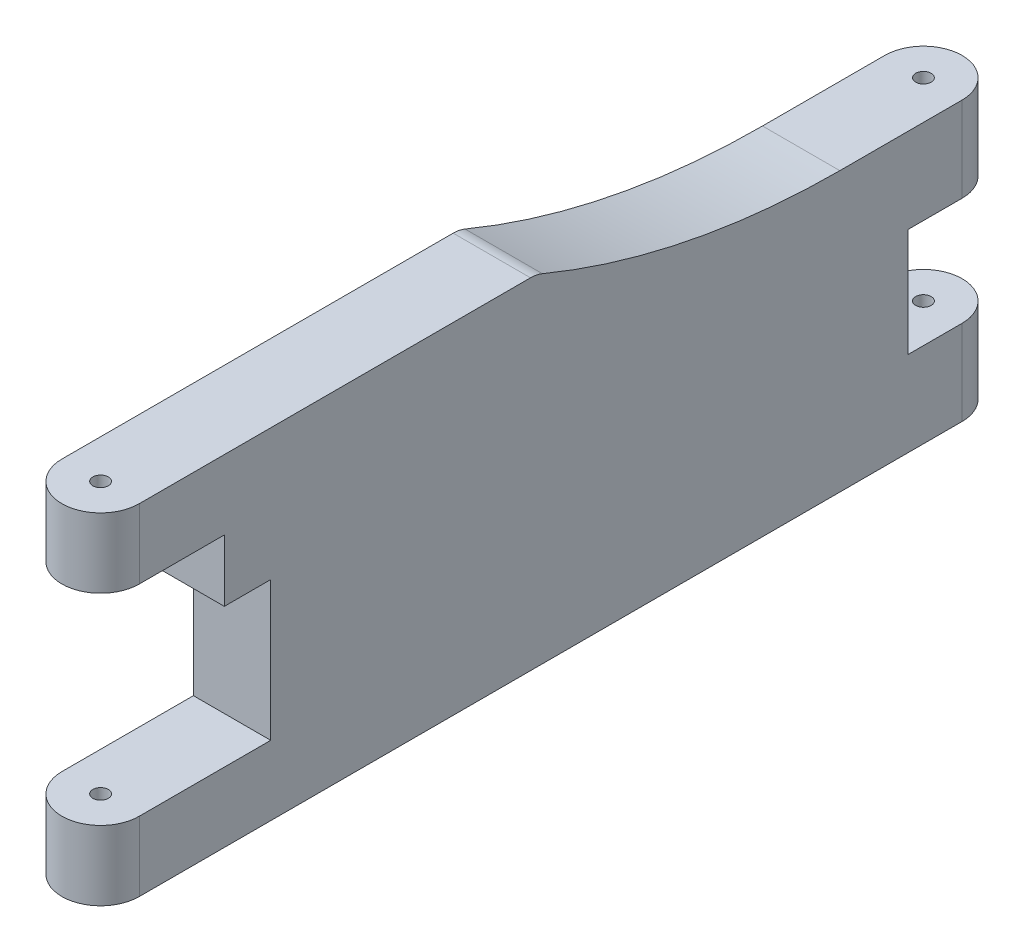
from build123d import *

# Parameters (mm, degrees)
SKETCHSIDE_R                    = 0.5
BOSSEXTRUDESIDE_DEPTH           = 22
CUTEXTRUDEDISTALROOM_DEPTH      = 60.939469467
CUTEXTRUDEDISTALROOM_DEPTH_BACK = 60.939469467
SKETCHSESORROOM_W               = 5
SKETCHSESORROOM_H               = 10
CUTEXTRUDESENSORROOM_DEPTH      = 10
CUTEXTRUDESTRONGSIDE_DEPTH      = 60.939469467
CUTEXTRUDESTRONGSIDE_DEPTH_BACK = 60.939469467
SKETCHSTRONGSIDE_W              = 30
SKETCHSTRONGSIDE_H              = 4
FILLETSTRONGSIDE_R              = 50
FILLETSIDE_R                    = 2
CUTEXTRUDESPRINGROOM_DEPTH      = 60.939469467
CUTEXTRUDESPRINGROOM_DEPTH_BACK = 60.939469467
SKETCHSPRINGROOM_W              = 6
SKETCHSPRINGROOM_H              = 7


with BuildPart() as part:
    # SketchSide → BossExtrudeSide (new body)
    with BuildSketch(Plane(origin=(0, 0, 0), x_dir=(1, 0, 0), z_dir=(0, 1, 0))):
        with BuildLine():
            Line((-2.5, -24.778081045), (-2.5, 0))
            ThreePointArc((-2.5, 0), (0, 2.5), (2.5, 0))
            Line((2.5, 0), (2.5, -53.2))
            ThreePointArc((2.5, -53.2), (0, -55.7), (-2.5, -53.2))
            Line((-2.5, -53.2), (-2.5, -24.778081045))
        make_face()
        with Locations(Location((0, 0, 0), (0, 0, 270))):
            Circle(SKETCHSIDE_R, mode=Mode.SUBTRACT)
        with Locations(Location((0, -53.2, 0), (0, 0, 270))):
            Circle(SKETCHSIDE_R, mode=Mode.SUBTRACT)
    extrude(amount=BOSSEXTRUDESIDE_DEPTH)

    # SketchDistalRoom → CutExtrudeDistalRoom (cut, two sides: drawn at the far end of the back side and taken through both)
    with BuildSketch(Plane(origin=(0, 0, 0), x_dir=(0, 0, -1), z_dir=(1, 0, 0)).offset(-CUTEXTRUDEDISTALROOM_DEPTH_BACK)):
        Polygon((-44.7, 13.5), (-47.7, 13.5), (-47.7, 17.5), (-55.7, 17.5), (-55.7, 4.5), (-44.7, 4.5), align=None)
    extrude(amount=CUTEXTRUDEDISTALROOM_DEPTH + CUTEXTRUDEDISTALROOM_DEPTH_BACK, mode=Mode.SUBTRACT)

    # SketchSesorRoom → CutExtrudeSensorRoom (cut)
    with BuildSketch(Plane(origin=(0, 0, 0), x_dir=(0, 0, -1), z_dir=(1, 0, 0))):
        with Locations((-34.2, 9)):
            Rectangle(SKETCHSESORROOM_W, SKETCHSESORROOM_H)
    extrude(amount=-CUTEXTRUDESENSORROOM_DEPTH, mode=Mode.SUBTRACT)

    # SketchStrongSide → CutExtrudeStrongSide (cut, two sides: drawn at the far end of the back side and taken through both)
    with BuildSketch(Plane(origin=(0, 0, 0), x_dir=(0, 0, -1), z_dir=(1, 0, 0)).offset(-CUTEXTRUDESTRONGSIDE_DEPTH_BACK)):
        with Locations((-12.5, 20)):
            Rectangle(SKETCHSTRONGSIDE_W, SKETCHSTRONGSIDE_H)
    extrude(amount=CUTEXTRUDESTRONGSIDE_DEPTH + CUTEXTRUDESTRONGSIDE_DEPTH_BACK, mode=Mode.SUBTRACT)

    # FilletStrongSide
    # the kernel refuses this fillet: 50 mm, written as the material it adds along each edge
    with BuildSketch(Plane(origin=(2.5, 18, 27.5), x_dir=(0, 1, 0), z_dir=(-1, 0, 0))) as filletstrongside_piece_1:
        with BuildLine():
            CenterArc((50, 19.595917942), FILLETSTRONGSIDE_R, 180, 23.073918066)
            Line((0, 19.595917942), (-1, 19.595917942))
            Line((-1, 19.595917942), (-1, 0))
            Line((-1, 0), (0, -1))
            ThreePointArc((0, -1), (2, -1), (3.08, -0.391918359))
            Line((3.08, -0.391918359), (4, 0))
        make_face()
    extrude(amount=5)

    # FilletSide
    filletside_edges = [part.edges().sort_by_distance(p)[0] for p in [
        (0, 22, 27.5),
    ]]
    fillet(filletside_edges, radius=FILLETSIDE_R)

    # SketchSpringRoom → CutExtrudeSpringRoom (cut, two sides: drawn at the far end of the back side and taken through both)
    with BuildSketch(Plane(origin=(0, 0, 0), x_dir=(0, 0, -1), z_dir=(1, 0, 0)).offset(-CUTEXTRUDESPRINGROOM_DEPTH_BACK)):
        with Locations((-0.5, 9)):
            Rectangle(SKETCHSPRINGROOM_W, SKETCHSPRINGROOM_H)
    extrude(amount=CUTEXTRUDESPRINGROOM_DEPTH + CUTEXTRUDESPRINGROOM_DEPTH_BACK, mode=Mode.SUBTRACT)


solid = part.part
